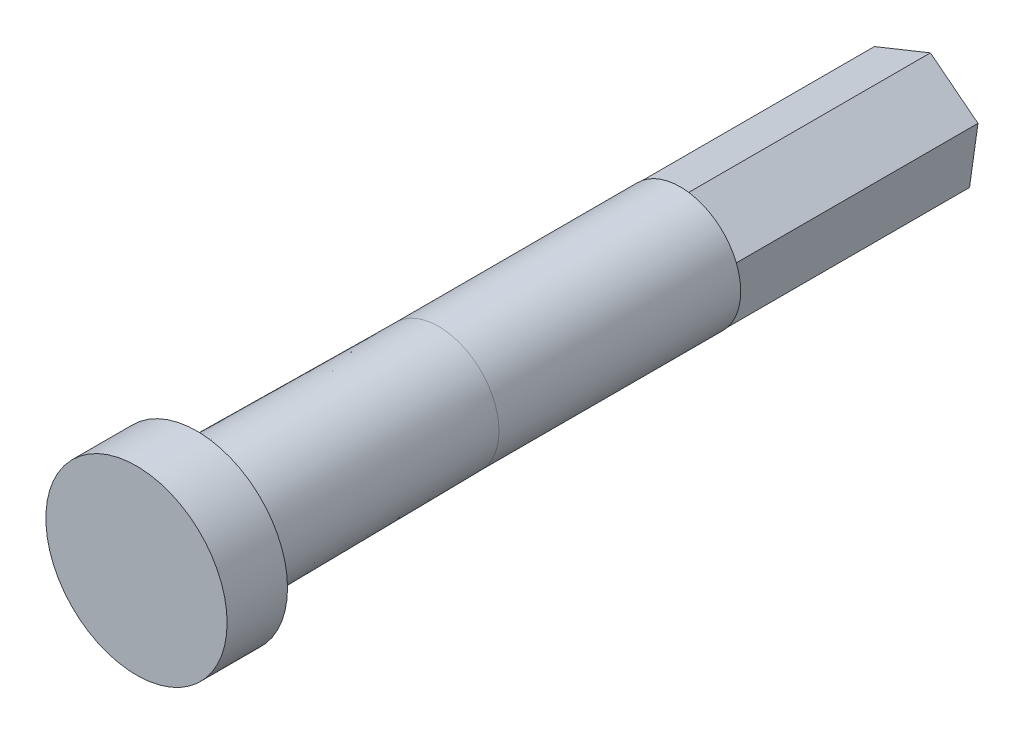
from build123d import *

# Parameters (mm, degrees)
SKETCH1_R           = 5
BOSS_EXTRUDE1_DEPTH = 20
BOSS_EXTRUDE1_DRAFT = -0.6
SKETCH2_R           = 7.5
BOSS_EXTRUDE2_DEPTH = 5
SKETCH9_R           = 5
BOSS_EXTRUDE4_DEPTH = 20
BOSS_EXTRUDE5_DEPTH = 20
SKETCH11_R          = 2
CUT_EXTRUDE5_DEPTH  = 6


with BuildPart() as part:
    # Sketch1 → Boss-Extrude1 (with draft: the straight prism first)
    with BuildSketch(Plane.XY):
        Circle(SKETCH1_R)
    extrude(amount=BOSS_EXTRUDE1_DEPTH)
    # Boss-Extrude1: the draft: its side faces are tilted about the plane it starts from
    boss_extrude1_sides = [part.faces().sort_by_distance(p)[0] for p in [
        (-5, 0, 10),
    ]]
    draft(boss_extrude1_sides, Plane.XY, BOSS_EXTRUDE1_DRAFT)

    # Sketch2 → Boss-Extrude2 (add)
    with BuildSketch(Plane.XY.offset(20)):
        Circle(SKETCH2_R)
    extrude(amount=BOSS_EXTRUDE2_DEPTH)

    # Sketch9 → Boss-Extrude4 (add)
    with BuildSketch(Plane(origin=(0, 0, 0), x_dir=(-1, 0, 0), z_dir=(0, 0, -1))):
        Circle(SKETCH9_R)
    extrude(amount=BOSS_EXTRUDE4_DEPTH)

    # Sketch10 → Boss-Extrude5 (add)
    with BuildSketch(Plane(origin=(0, 0, -20), x_dir=(-1, 0, 0), z_dir=(0, 0, -1))):
        Polygon((-3.936795807, -3.082472834), (0.701101878, -4.950601595), (4.637897685, -1.868128761), (3.936795807, 3.082472834), (-0.701101878, 4.950601595), (-4.637897685, 1.868128761), align=None)
    extrude(amount=BOSS_EXTRUDE5_DEPTH)

    # Sketch11 → Cut-Extrude5 (cut)
    with BuildSketch(Plane(origin=(0, 0, -40), x_dir=(-1, 0, 0), z_dir=(0, 0, -1))):
        Circle(SKETCH11_R)
    extrude(amount=-CUT_EXTRUDE5_DEPTH, mode=Mode.SUBTRACT)


solid = part.part
